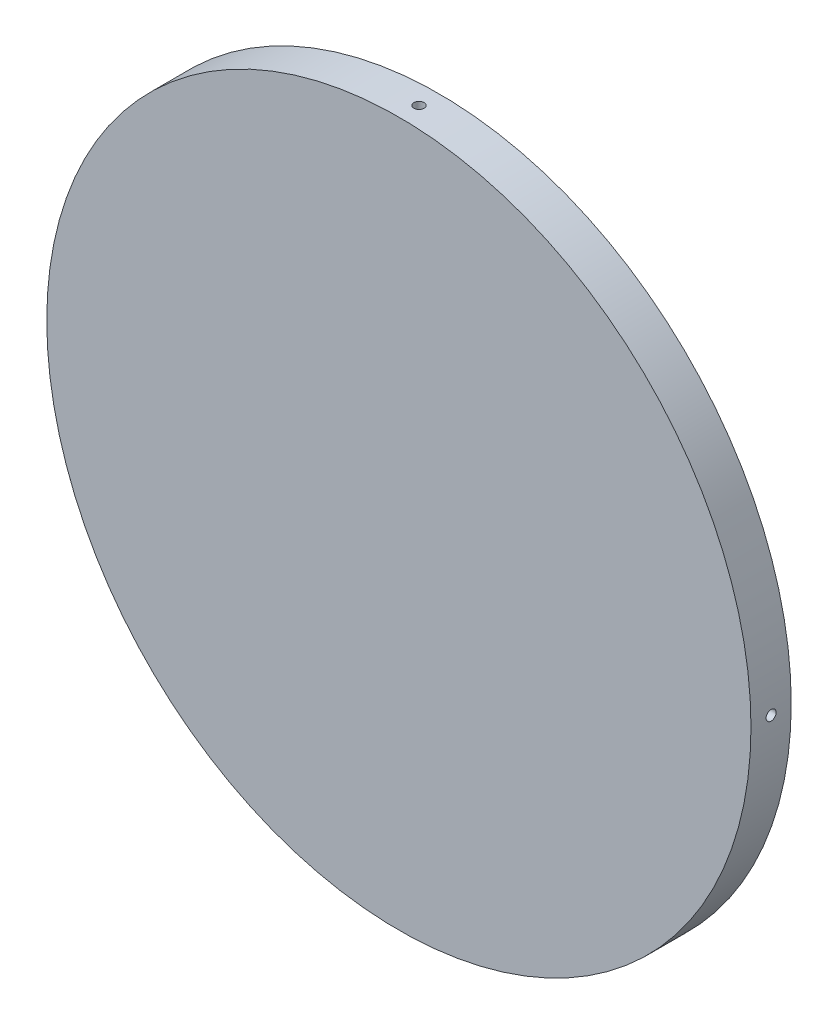
from build123d import *

# Parameters (mm, degrees)
SKETCH1_R           = 70
BOSS_EXTRUDE1_DEPTH = 8
SKETCH3_R           = 1
CUT_EXTRUDE1_DEPTH  = 12
CIRPATTERN1_COUNT   = 4


with BuildPart() as part:
    # Sketch1 → Boss-Extrude1 (new body)
    with BuildSketch(Plane.XY):
        Circle(SKETCH1_R)
    extrude(amount=BOSS_EXTRUDE1_DEPTH)

    # Sketch3 → Cut-Extrude1 (cut)
    with BuildSketch(Plane(origin=(0, 70, 0), x_dir=(1, 0, 0), z_dir=(0, 1, 0))):
        with Locations((0, -4)):
            Circle(SKETCH3_R)
    cut_extrude1 = extrude(amount=-CUT_EXTRUDE1_DEPTH, mode=Mode.SUBTRACT)

    # CirPattern1: Cut-Extrude1 ×4 about axis
    cirpattern1_axis = Axis((0, 0, 0), (0, 0, 1))
    for i in range(1, CIRPATTERN1_COUNT):
        add(cut_extrude1.rotate(cirpattern1_axis, i * 360 / CIRPATTERN1_COUNT), mode=Mode.SUBTRACT)


solid = part.part
